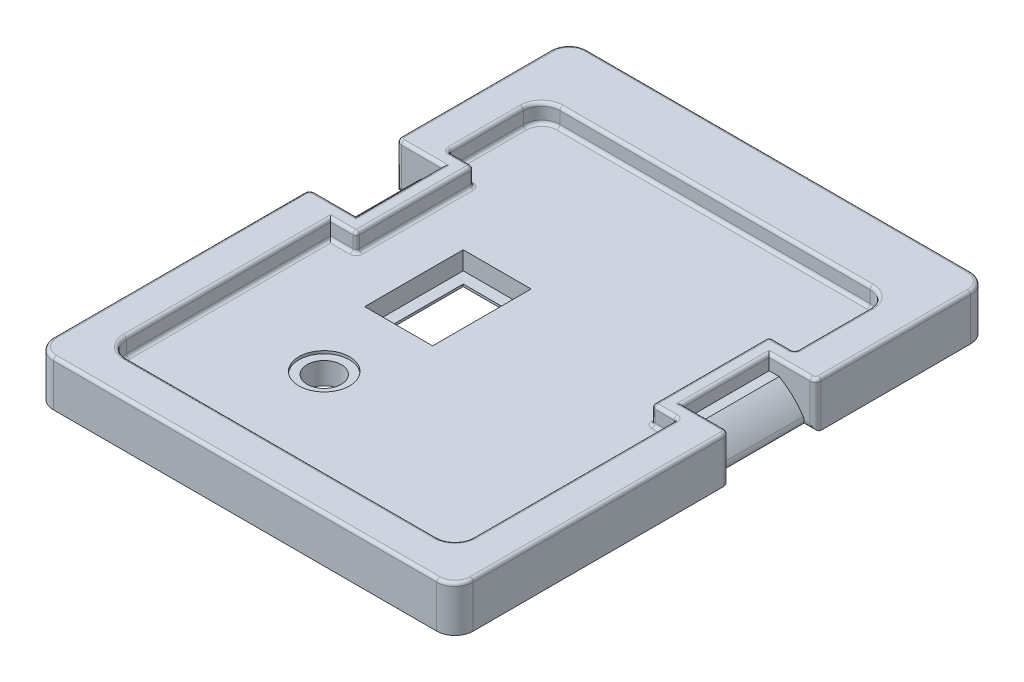
from build123d import *

# Parameters (mm, degrees)
BOSS_EXTRUDE1_DEPTH = 5
CUT_EXTRUDE1_DEPTH  = 2
CUT_EXTRUDE2_REACH  = 76.587
SKETCH3_W           = 9.464924718
SKETCH3_H           = 1.600101089
FILLET2_R           = 8
FILLET3_R           = 0.6
FILLET4_R           = 0.6
BOSS_EXTRUDE2_DEPTH = 2
FILLET5_R           = 0.35
SKETCH5_W           = 1.1
SKETCH5_H           = 9.464924718
BOSS_EXTRUDE3_DEPTH = 0.399899
SKETCH6_W           = 7.444621866
SKETCH6_H           = 10.8
CUT_EXTRUDE3_DEPTH  = 5
SKETCH7_W           = 7.444621866
SKETCH7_H           = 10.8
SKETCH7_W_2         = 4.944621866
SKETCH7_H_2         = 8.3
BOSS_EXTRUDE4_DEPTH = 1
CHAMFER1_SIZE       = 0.75
SKETCH8_R           = 1.875
CUT_EXTRUDE4_DEPTH  = 30
SKETCH10_R          = 2.775
CUT_EXTRUDE5_DEPTH  = 0.3
SKETCH11_R          = 2.5
CUT_EXTRUDE6_DEPTH  = 0.3


with BuildPart() as part:
    # Sketch1 → Boss-Extrude1 (new body)
    with BuildSketch(Plane(origin=(0, 0, 0), x_dir=(1, 0, 0), z_dir=(0, 1, 0))):
        with BuildLine():
            Line((2, 0), (44, 0))
            ThreePointArc((44, 0), (45.414213562, 0.585786438), (46, 2))
            Line((46, 2), (46, 56.5))
            ThreePointArc((46, 56.5), (45.414213562, 57.914213562), (44, 58.5))
            Line((44, 58.5), (2, 58.5))
            ThreePointArc((2, 58.5), (0.585786438, 57.914213562), (0, 56.5))
            Line((0, 56.5), (0, 2))
            ThreePointArc((0, 2), (0.585786438, 0.585786438), (2, 0))
        make_face()
    extrude(amount=BOSS_EXTRUDE1_DEPTH)

    # Sketch2 → Cut-Extrude1 (cut)
    with BuildSketch(Plane(origin=(0, 5, 0), x_dir=(1, 0, 0), z_dir=(0, 1, 0))):
        with BuildLine():
            ThreePointArc((4, 49.5), (4.585786438, 50.914213562), (6, 51.5))
            Line((6, 51.5), (40, 51.5))
            ThreePointArc((40, 51.5), (41.414213562, 50.914213562), (42, 49.5))
            Line((42, 49.5), (42, 6))
            ThreePointArc((42, 6), (41.414213562, 4.585786438), (40, 4))
            Line((40, 4), (6, 4))
            ThreePointArc((6, 4), (4.585786438, 4.585786438), (4, 6))
            Line((4, 6), (4, 49.5))
        make_face()
    extrude(amount=-CUT_EXTRUDE1_DEPTH, mode=Mode.SUBTRACT)

    # Cut-Extrude2: up to this face of the body (flat: up to its plane)
    cut_extrude2_end = Plane(part.part.faces().sort_by_distance((0, 2.5, -29.25))[0])
    # Sketch3 → Cut-Extrude2 (cut, up to the picked face)
    with BuildSketch(Plane(origin=(46, 0, 0), x_dir=(0, 0, -1), z_dir=(1, 0, 0)), mode=Mode.PRIVATE) as cut_extrude2_sk1:
        with Locations((34.800208847, 4.199949456)):
            Rectangle(SKETCH3_W, SKETCH3_H)
    cut_extrude2_tool1 = split(extrude(cut_extrude2_sk1.sketch, amount=-CUT_EXTRUDE2_REACH, mode=Mode.PRIVATE), bisect_by=cut_extrude2_end, keep=Keep.BOTH, mode=Mode.PRIVATE)
    add(cut_extrude2_tool1.solids().sort_by(Axis((46, 4.199949, -34.800209), (-1, 0, 0)))[0], mode=Mode.SUBTRACT)

    # Fillet2
    # the kernel refuses this fillet: 8 mm, written as the material it takes off along each edge
    with BuildSketch(Plane(origin=(46, 3.399898911, -30.067746488), x_dir=(0, -1, 0), z_dir=(0, 0, -1))) as fillet2_piece_1:
        with BuildLine():
            CenterArc((6.92820323, 8), FILLET2_R, 210, 60)
            Line((0, 4), (0, 0))
            Line((0, 0), (6.92820323, 0))
        make_face()
    extrude(amount=9.464924718, mode=Mode.SUBTRACT)
    with BuildSketch(Plane(origin=(0, 3.399898911, -30.067746488), x_dir=(0, -1, 0), z_dir=(0, 0, -1))) as fillet2_piece_2:
        with BuildLine():
            CenterArc((6.92820323, -8), FILLET2_R, 90, 60)
            Line((0, -4), (0, 0))
            Line((0, 0), (6.92820323, 0))
        make_face()
    extrude(amount=9.464924718, mode=Mode.SUBTRACT)

    # Fillet3
    fillet3_edges = [part.edges().sort_by_distance(p)[0] for p in [
        (45.179907286, 0, -34.800208847),
        (0.820092714, 0, -34.800208847),
    ]]
    fillet(fillet3_edges, radius=FILLET3_R)

    # Fillet4
    fillet4_edges = [part.edges().sort_by_distance(p)[0] for p in [
        (46, 2.5, -30.067746488),
        (46, 2.5, -39.532671206),
        (0, 2.5, -39.532671206),
        (0, 2.5, -30.067746488),
        (45.070712598, 0, -30.067746488),
        (45.070712598, 0, -39.532671206),
        (0.929287402, 0, -39.532671206),
        (0.929287402, 0, -30.067746488),
    ]]
    fillet(fillet4_edges, radius=FILLET4_R)

    # Sketch4 → Boss-Extrude2 (add)
    with BuildSketch(Plane(origin=(0, 3, 0), x_dir=(1, 0, 0), z_dir=(0, 1, 0))):
        Polygon((4, 39.532671206), (5.1, 39.532671206), (5.1, 30.067746488), (4, 30.067746488), (4, 28.367746488), (6.8, 28.367746488), (6.8, 41.232671206), (4, 41.232671206), align=None)
        Polygon((40.9, 30.067746488), (42, 30.067746488), (42, 28.367746488), (39.2, 28.367746488), (39.2, 41.232671206), (42, 41.232671206), (42, 39.532671206), (40.9, 39.532671206), align=None)
    extrude(amount=BOSS_EXTRUDE2_DEPTH)

    # Fillet5
    fillet5_edges = [part.edges().sort_by_distance(p)[0] for p in [
        (45.414213562, 5, -0.585786438),
        (46, 5, -15.733873244),
        (46, 5, -48.316335603),
        (2.85, 5, -39.532671206),
        (0.175735931, 5, -39.708407137),
        (45.824264069, 5, -39.708407137),
        (2.85, 5, -30.067746488),
        (0, 5, -15.733873244),
        (0.175735931, 5, -29.892010557),
        (45.824264069, 5, -29.892010557),
        (45.414213562, 5, -57.914213562),
        (4, 3, -17.183873244),
        (4, 5, -17.183873244),
        (4, 4, -41.232671206),
        (5.4, 3, -28.367746488),
        (6.8, 4, -28.367746488),
        (6.8, 3, -34.800208847),
        (6.8, 4, -41.232671206),
        (5.4, 3, -41.232671206),
        (5.4, 5, -41.232671206),
        (5.1, 5, -34.800208847),
        (5.4, 5, -28.367746488),
        (6.8, 5, -34.800208847),
        (23, 5, -58.5),
        (42, 3, -17.183873244),
        (42, 5, -17.183873244),
        (42, 4, -41.232671206),
        (40.6, 3, -41.232671206),
        (39.2, 4, -41.232671206),
        (39.2, 3, -34.800208847),
        (39.2, 4, -28.367746488),
        (40.6, 3, -28.367746488),
        (42, 4, -28.367746488),
        (40.9, 5, -34.800208847),
        (40.6, 5, -41.232671206),
        (39.2, 5, -34.800208847),
        (40.6, 5, -28.367746488),
        (0.585786438, 5, -57.914213562),
        (4.585786438, 5, -50.914213562),
        (23, 5, -51.5),
        (41.414213562, 3, -50.914213562),
        (42, 5, -45.366335603),
        (41.414213562, 5, -4.585786438),
        (23, 3, -4),
        (4.585786438, 5, -4.585786438),
        (4, 3, -45.366335603),
        (4.585786438, 3, -50.914213562),
        (23, 3, -51.5),
        (42, 3, -45.366335603),
        (0, 5, -48.316335603),
        (41.414213562, 3, -4.585786438),
        (4.585786438, 3, -4.585786438),
        (4, 5, -45.366335603),
        (23, 5, -4),
        (41.414213562, 5, -50.914213562),
        (0.585786438, 5, -0.585786438),
        (43.15, 5, -30.067746488),
        (43.15, 5, -39.532671206),
        (23, 5, 0),
    ]]
    fillet(fillet5_edges, radius=FILLET5_R)

    # Sketch5 → Boss-Extrude3 (add)
    with BuildSketch(Plane(origin=(0, 3, 0), x_dir=(1, 0, 0), z_dir=(0, 1, 0))):
        with Locations((4.55, 34.800208847)):
            Rectangle(SKETCH5_W, SKETCH5_H)
        with Locations((41.45, 34.800208847)):
            Rectangle(SKETCH5_W, SKETCH5_H)
    extrude(amount=BOSS_EXTRUDE3_DEPTH)

    # Sketch6 → Cut-Extrude3 (cut)
    with BuildSketch(Plane(origin=(0, 5, 0), x_dir=(1, 0, 0), z_dir=(0, 1, 0))):
        with Locations((15.972310933, 29.25)):
            Rectangle(SKETCH6_W, SKETCH6_H)
    extrude(amount=-CUT_EXTRUDE3_DEPTH, mode=Mode.SUBTRACT)

    # Sketch7 → Boss-Extrude4 (add)
    with BuildSketch(Plane.XZ):
        with Locations((15.972310933, -29.25)):
            Rectangle(SKETCH7_W, SKETCH7_H)
        with Locations((15.972310933, -29.25)):
            Rectangle(SKETCH7_W_2, SKETCH7_H_2, mode=Mode.SUBTRACT)
    extrude(amount=-BOSS_EXTRUDE4_DEPTH)

    # Chamfer1
    chamfer1_edges = [part.edges().sort_by_distance(p)[0] for p in [
        (15.972310933, 0, -33.4),
        (13.5, 0, -29.25),
        (15.972310933, 0, -25.1),
        (18.444621866, 0, -29.25),
    ]]
    chamfer(chamfer1_edges, length=CHAMFER1_SIZE)

    # Sketch8 → Cut-Extrude4 (cut)
    with BuildSketch(Plane(origin=(0, 30, 0), x_dir=(1, 0, 0), z_dir=(0, 1, 0))):
        with Locations(Location((16.168869593, 15.5, 0), (0, 0, 270))):
            Circle(SKETCH8_R)
    extrude(amount=-CUT_EXTRUDE4_DEPTH, mode=Mode.SUBTRACT)

    # Sketch10 → Cut-Extrude5 (cut)
    with BuildSketch(Plane(origin=(0, 3, 0), x_dir=(1, 0, 0), z_dir=(0, 1, 0))):
        with Locations(Location((16.168869593, 15.5, 0), (0, 0, 270))):
            Circle(SKETCH10_R)
    extrude(amount=-CUT_EXTRUDE5_DEPTH, mode=Mode.SUBTRACT)

    # Sketch11 → Cut-Extrude6 (cut)
    with BuildSketch(Plane.XZ):
        with Locations(Location((16.168869593, -15.5, 0), (0, 0, 270))):
            Circle(SKETCH11_R)
    extrude(amount=-CUT_EXTRUDE6_DEPTH, mode=Mode.SUBTRACT)


solid = part.part
